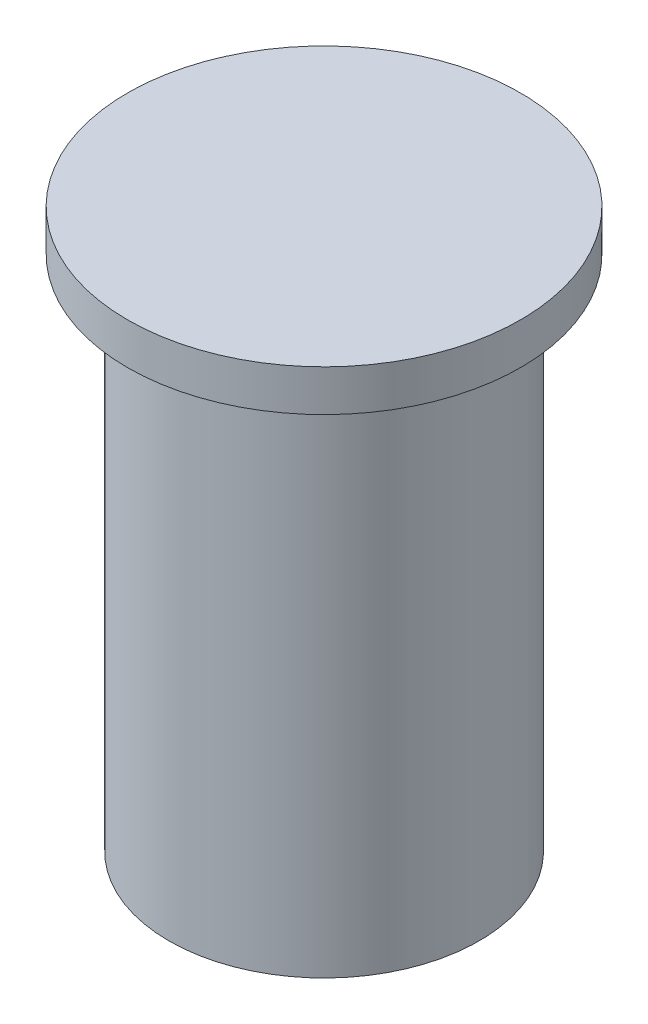
from build123d import *


with BuildPart() as part:
    # Sketch1 → Revolve1 (revolve)
    with BuildSketch(Plane(origin=(0, 0, 0), x_dir=(0, 0, -1), z_dir=(1, 0, 0))):
        Polygon((0, -5), (0, 0.4), (-1.9, 0.4), (-1.9, 0), (-1.5, 0), (-1.5, -5), align=None)
    revolve(axis=Axis((0, 0.4, 0), (0, -1, 0)))


solid = part.part
